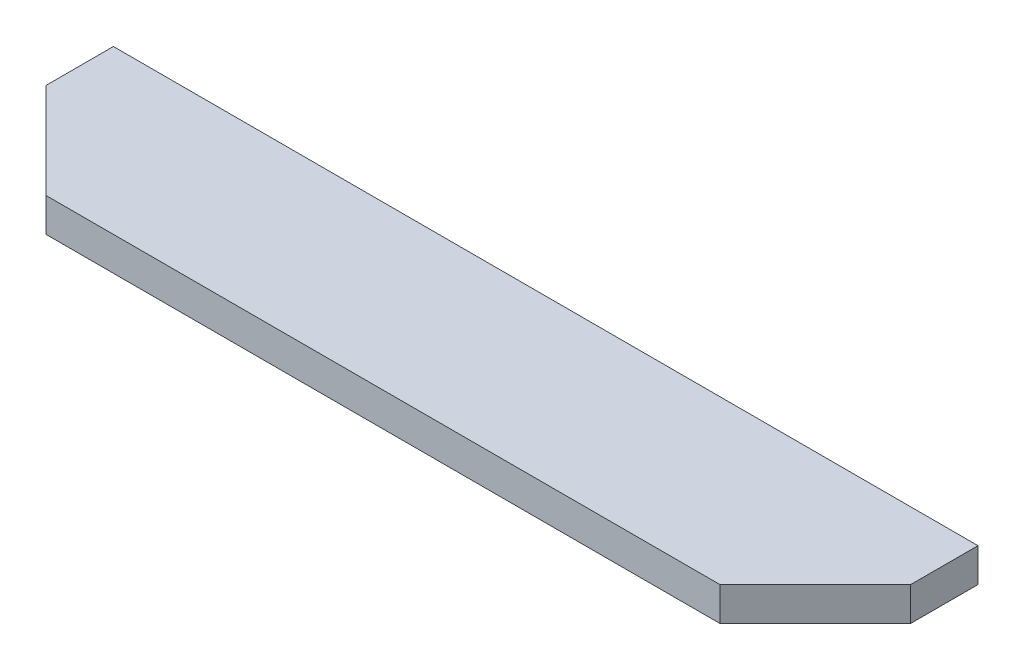
from build123d import *

# Parameters (mm, degrees)
BOSS_EXTRUDE1_DEPTH = 5


with BuildPart() as part:
    # Sketch2 → Boss-Extrude1 (new body)
    with BuildSketch(Plane(origin=(0, 0, 0), x_dir=(1, 0, 0), z_dir=(0, 1, 0))):
        Polygon((0, 0), (-100, 0), (-114.142135624, 14.142135624), (-114.142135624, 24.142135624), (14.142135624, 24.142135624), (14.142135624, 14.142135624), align=None)
    extrude(amount=BOSS_EXTRUDE1_DEPTH)


solid = part.part
